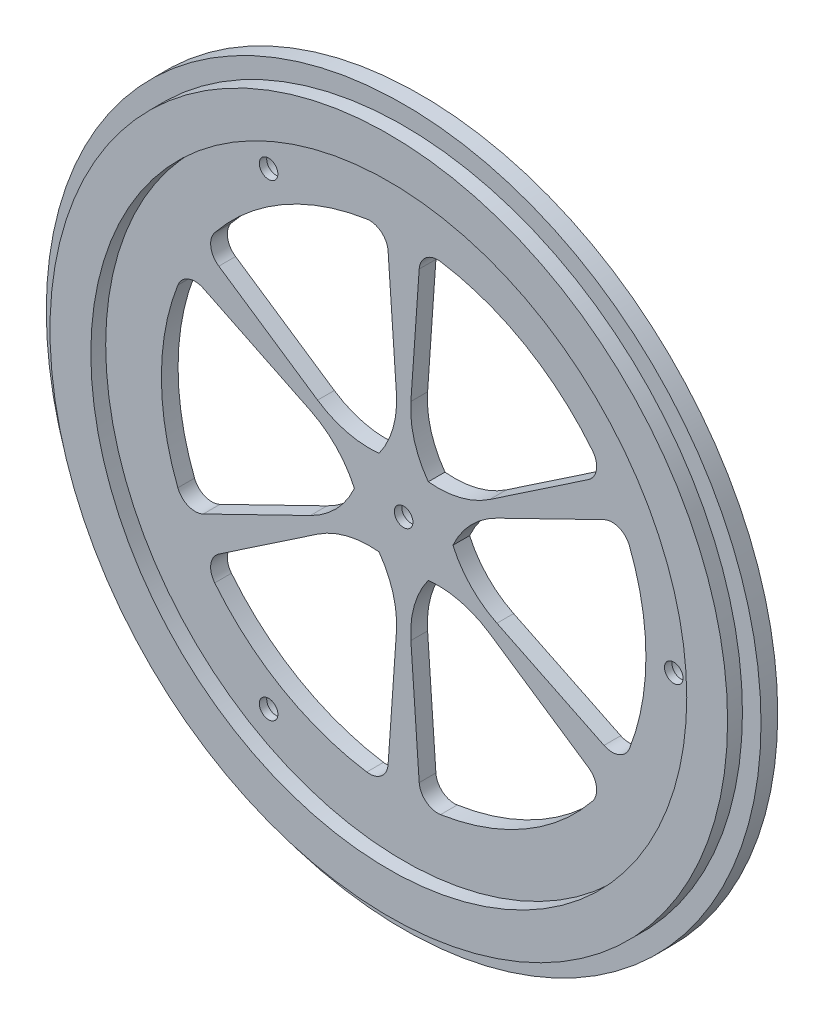
from build123d import *

# Parameters (mm, degrees)
SKETCH_1_R                       = 38.5
EXTRUDE_1_DEPTH                  = 2
SKETCH_2_OUTSIDE_W               = 100.782
SKETCH_2_OUTSIDE_H               = 100.782
SKETCH_2_OUTSIDE_R               = 36.5
SKETCH_2_OUTSIDE_R_2             = 32.1
CUT_EXTRUDE_1_DEPTH              = 0.2
EXTRUDE_START                    = 1.4
SKETCH_2_2_R                     = 36.5
SKETCH_2_2_R_2                   = 32.1
EXTRUDE_2_DEPTH                  = 1.4
SKETCH_3_R                       = 26.1
CUT_EXTRUDE_2_DEPTH              = 55.47696761
SKETCH_3_3_R                     = 5
EXTRUDE_3_DEPTH                  = 1.8
EXTRUDE_4_DEPTH                  = 1.8
FILLET_1_R                       = 2
PATTERN_CIRCULAR_1_COUNT         = 6
FILLET_1_OF_PATTERN_CIRCULAR_1_R = 2
FILLET_2_R                       = 10
SKETCH_4_R                       = 1
CUT_EXTRUDE_3_DEPTH              = 55.47696761
CUT_EXTRUDE_START                = -1.8
SKETCH_4_3_R                     = 1.5
CUT_EXTRUDE_4_DEPTH              = 1


with BuildPart() as part:
    # 草图1 → 凸台-拉伸1 (new body)
    with BuildSketch(Plane.XY):
        Circle(SKETCH_1_R)
    extrude(amount=EXTRUDE_1_DEPTH)

    # 草图2 outside → 切除-拉伸1 (cut)
    # profile 1 of 2: a face of its own
    with BuildSketch(Plane.XY.offset(2)):
        Rectangle(SKETCH_2_OUTSIDE_W, SKETCH_2_OUTSIDE_H)
        Circle(SKETCH_2_OUTSIDE_R, mode=Mode.SUBTRACT)
    # profile 2 of 2: a face of its own
    with BuildSketch(Plane.XY.offset(2)):
        Circle(SKETCH_2_OUTSIDE_R_2)
    extrude(amount=-CUT_EXTRUDE_1_DEPTH, mode=Mode.SUBTRACT)

    # 草图2<2> → 凸台-拉伸2 (add)
    with BuildSketch(Plane.XY.offset(2).offset(EXTRUDE_START)):
        Circle(SKETCH_2_2_R)
        Circle(SKETCH_2_2_R_2, mode=Mode.SUBTRACT)
    extrude(amount=-EXTRUDE_2_DEPTH)

    # 草图3 → 切除-拉伸2 (cut, through all)
    with BuildSketch(Plane.XY.offset(1.8)):
        Circle(SKETCH_3_R)
    extrude(amount=-CUT_EXTRUDE_2_DEPTH, mode=Mode.SUBTRACT)



with BuildPart() as body_2:
    # 草图3<3> → 凸台-拉伸3 (new, through all)
    with BuildSketch(Plane.XY.offset(1.8)):
        Circle(SKETCH_3_3_R)
    extrude(amount=-EXTRUDE_3_DEPTH)


with BuildPart() as part_1:
    add(part.part)

    add(body_2.part)  # 凸台-拉伸4 merges body 2
    # 草图3<4> → 凸台-拉伸4 (add, through all)
    with BuildSketch(Plane.XY.offset(1.8)):
        with BuildLine():
            ThreePointArc((1.820643965, 26.036421712), (0, 26.1), (-1.820643965, 26.036421712))
            Line((-1.820643965, 26.036421712), (-0.348782369, 4.987820251))
            ThreePointArc((-0.348782369, 4.987820251), (0, 5), (0.348782369, 4.987820251))
            Line((0.348782369, 4.987820251), (1.820643965, 26.036421712))
        make_face()
    extrude_4 = extrude(amount=-EXTRUDE_4_DEPTH)

    # 圆角1
    fillet_1_edges = [part_1.edges().sort_by_distance(p)[0] for p in [
        (-1.820643965, 26.036421712, 0.9),
        (1.820643965, 26.036421712, 0.9),
    ]]
    fillet(fillet_1_edges, radius=FILLET_1_R)

    # 阵列(圆周)1: 凸台-拉伸4 ×6 about axis
    pattern_circular_1_axis = Axis((0, 0, 0), (0, 0, 1))
    for i in range(1, PATTERN_CIRCULAR_1_COUNT):
        add(extrude_4.rotate(pattern_circular_1_axis, i * 360 / PATTERN_CIRCULAR_1_COUNT))

    # 圆角1 of 阵列(圆周)1
    fillet_1_of_pattern_circular_1_edges = [part_1.edges().sort_by_distance(p)[0] for p in [
        (-23.458524608, 11.441486931, 0.9),
        (-21.637880644, 14.594934781, 0.9),
        (-21.637880644, -14.594934781, 0.9),
        (-23.458524608, -11.441486931, 0.9),
        (1.820643965, -26.036421712, 0.9),
        (-1.820643965, -26.036421712, 0.9),
        (23.458524608, -11.441486931, 0.9),
        (21.637880644, -14.594934781, 0.9),
        (21.637880644, 14.594934781, 0.9),
        (23.458524608, 11.441486931, 0.9),
    ]]
    fillet(fillet_1_of_pattern_circular_1_edges, radius=FILLET_1_OF_PATTERN_CIRCULAR_1_R)

    # 圆角2
    # the kernel refuses this fillet: 10 mm, written as the material it adds along each edge
    with BuildSketch(Plane(origin=(4.493970231, -2.191855734, 1.8), x_dir=(0.8987940462991597, -0.4383711467890922, 0), z_dir=(0, 0, -1)), Plane(origin=(0.348782369, -4.987820251, 1.8), x_dir=(0.06975647374410966, -0.9975640502598253, 0), z_dir=(0, 0, -1)), Plane(origin=(-4.145187863, -2.795964517, 1.8), x_dir=(-0.8290375725550504, -0.5591929034707338, 0), z_dir=(0, 0, -1)), Plane(origin=(-4.493970231, 2.191855734, 1.8), x_dir=(-0.8987940462991602, 0.4383711467890914, 0), z_dir=(0, 0, -1)), Plane(origin=(-0.348782369, 4.987820251, 1.8), x_dir=(-0.06975647374410977, 0.9975640502598253, 0), z_dir=(0, 0, -1)), Plane(origin=(4.145187863, 2.795964517, 1.8), x_dir=(0.8290375725550504, 0.5591929034707338, 0), z_dir=(0, 0, -1))) as fillet_2_piece_1:
        with BuildLine():
            CenterArc((6.180339887, -10), FILLET_2_R, 90, 48.189685104)
            ThreePointArc((-1.273220038, -3.333333333), (-0.329138205, -1.784110449), (0, 0))
            Line((0, 0), (6.180339887, 0))
        make_face()
    extrude(amount=1.8)
    with BuildSketch(Plane(origin=(4.493970231, 2.191855734, 1.8), x_dir=(0.8987940462991614, 0.4383711467890888, 0), z_dir=(0, 0, -1)), Plane(origin=(4.145187863, -2.795964517, 1.8), x_dir=(0.8290375725550488, -0.5591929034707364, 0), z_dir=(0, 0, -1)), Plane(origin=(-0.348782369, -4.987820251, 1.8), x_dir=(-0.06975647374411244, -0.9975640502598251, 0), z_dir=(0, 0, -1)), Plane(origin=(-4.493970231, -2.191855734, 1.8), x_dir=(-0.8987940462991615, -0.43837114678908895, 0), z_dir=(0, 0, -1)), Plane(origin=(-4.145187863, 2.795964517, 1.8), x_dir=(-0.8290375725550488, 0.5591929034707362, 0), z_dir=(0, 0, -1)), Plane(origin=(0.348782369, 4.987820251, 1.8), x_dir=(0.06975647374411233, 0.9975640502598251, 0), z_dir=(0, 0, -1))) as fillet_2_piece_2:
        with BuildLine():
            CenterArc((6.180339887, 10), FILLET_2_R, 221.810314896, 48.189685104)
            ThreePointArc((-1.273220038, 3.333333333), (-0.329138205, 1.784110449), (0, 0))
            Line((0, 0), (6.180339887, 0))
        make_face()
    extrude(amount=1.8)

    # 草图4 → 切除-拉伸3 (cut, through all)
    with BuildSketch(Plane.XY.offset(1.8)):
        with Locations((-14.55, 25.20133925)):
            Circle(SKETCH_4_R)
        Circle(SKETCH_4_R)
        with Locations((29.1, 0)):
            Circle(SKETCH_4_R)
        with Locations((-14.55, -25.20133925)):
            Circle(SKETCH_4_R)
    extrude(amount=-CUT_EXTRUDE_3_DEPTH, mode=Mode.SUBTRACT)

    # 草图4<3> → 切除-拉伸4 (cut)
    with BuildSketch(Plane.XY.offset(1.8).offset(CUT_EXTRUDE_START)):
        with Locations((-14.55, 25.20133925)):
            Circle(SKETCH_4_3_R)
        with Locations((29.1, 0)):
            Circle(SKETCH_4_3_R)
        with Locations((-14.55, -25.20133925)):
            Circle(SKETCH_4_3_R)
        Circle(SKETCH_4_3_R)
    extrude(amount=CUT_EXTRUDE_4_DEPTH, mode=Mode.SUBTRACT)


solid = part_1.part
